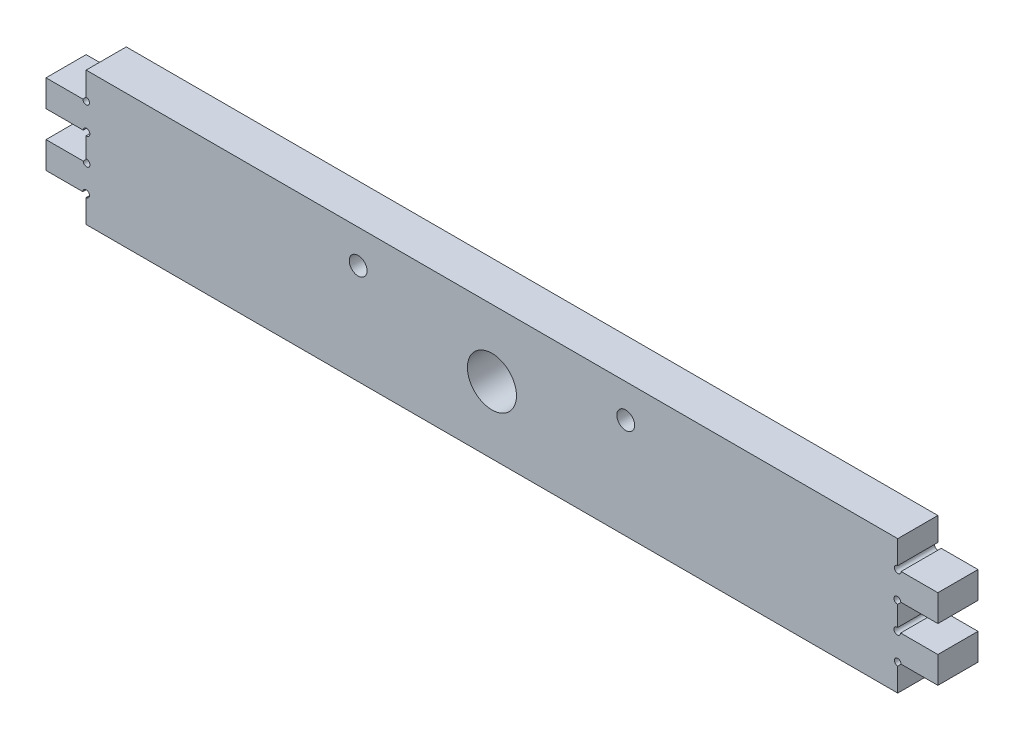
from build123d import *

# Parameters (mm, degrees)
SKETCH1_R           = 4
BOSS_EXTRUDE1_DEPTH = 18
CUT_EXTRUDE1_REACH  = 205.037
SKETCH2_R           = 11


with BuildPart() as part:
    # Sketch1 → Boss-Extrude1 (new body)
    with BuildSketch(Plane.XY):
        with BuildLine():
            Line((-182, -19.500000011), (-182, -30))
            Line((-182, -30), (182, -30))
            Line((182, -30), (182, -19.500000011))
            ThreePointArc((182, -19.500000011), (180.939339824, -16.939339843), (183.5, -18))
            Line((183.5, -18), (200, -18))
            Line((200, -18), (200, -6))
            Line((200, -6), (183.29903814, -6))
            ThreePointArc((183.29903814, -6), (180.665205617, -6.968465906), (182, -4.5))
            Line((182, -4.5), (182, 4.5))
            ThreePointArc((182, 4.5), (180.665205618, 6.968465906), (183.299038141, 6))
            Line((183.299038141, 6), (200, 6))
            Line((200, 6), (200, 18))
            Line((200, 18), (183.5, 18))
            ThreePointArc((183.5, 18), (180.939339828, 16.939339828), (182, 19.5))
            Line((182, 19.5), (182, 30))
            Line((182, 30), (-182, 30))
            Line((-182, 30), (-182, 19.5))
            ThreePointArc((-182, 19.5), (-180.939339828, 16.939339828), (-183.5, 18))
            Line((-183.5, 18), (-200, 18))
            Line((-200, 18), (-200, 6))
            Line((-200, 6), (-183.299038141, 6))
            ThreePointArc((-183.299038141, 6), (-180.665205618, 6.968465906), (-182, 4.5))
            Line((-182, 4.5), (-182, -4.5))
            ThreePointArc((-182, -4.5), (-180.665205617, -6.968465906), (-183.29903814, -6))
            Line((-183.29903814, -6), (-200, -6))
            Line((-200, -6), (-200, -18))
            Line((-200, -18), (-183.5, -18))
            ThreePointArc((-183.5, -18), (-180.939339824, -16.939339843), (-182, -19.500000011))
        make_face()
        with Locations((-60, 15)):
            Circle(SKETCH1_R, mode=Mode.SUBTRACT)
        Circle(SKETCH1_R, mode=Mode.SUBTRACT)
        with Locations((60, 15)):
            Circle(SKETCH1_R, mode=Mode.SUBTRACT)
    extrude(amount=BOSS_EXTRUDE1_DEPTH)

    # Sketch2 → Cut-Extrude1 (cut, up to next)
    with BuildSketch(Plane.XY.offset(18), mode=Mode.PRIVATE) as cut_extrude1_sk1:
        Circle(SKETCH2_R)
    cut_extrude1_tool1 = extrude(cut_extrude1_sk1.sketch, amount=-CUT_EXTRUDE1_REACH, mode=Mode.PRIVATE) & part.part
    add(cut_extrude1_tool1.solids().sort_by_distance((0, 0, 18))[0], mode=Mode.SUBTRACT)


solid = part.part
